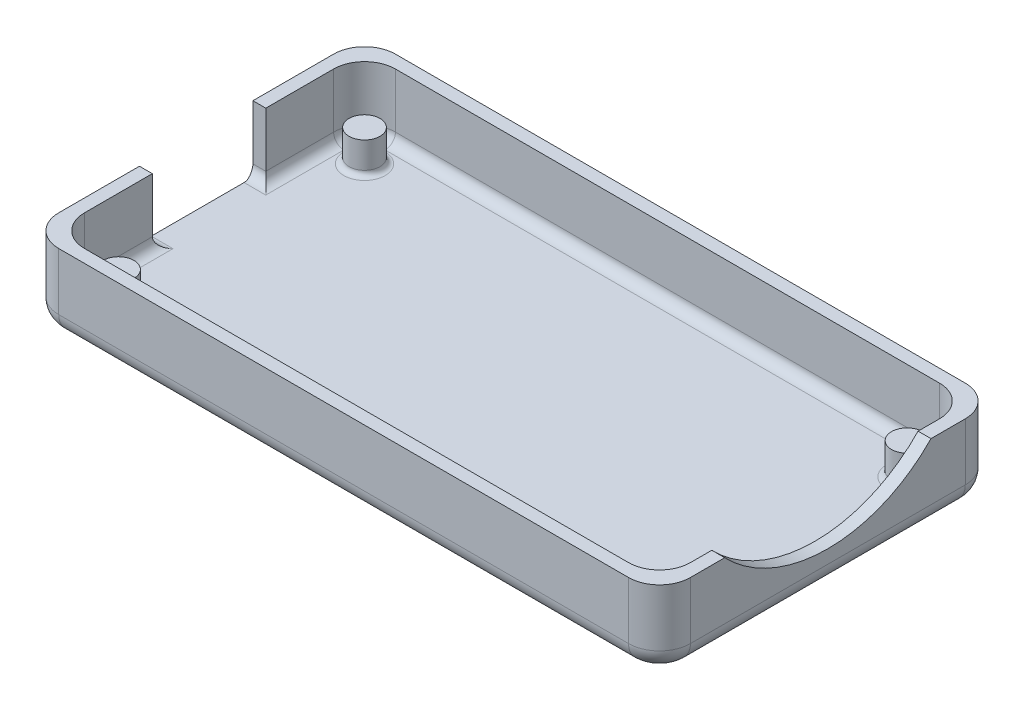
from build123d import *

# Parameters (mm, degrees)
BOSS_EXTRUDE2_DEPTH = 7.55
SKETCH3_W           = 58.75
SKETCH3_H           = 30.15
BOSS_EXTRUDE3_DEPTH = 1.25
SKETCH5_R           = 1.5
BOSS_EXTRUDE4_DEPTH = 3.05
FILLET1_R           = 0.5
FILLET4_R           = 2
SKETCH7_W           = 11
SKETCH7_H           = 6.3
CUT_EXTRUDE1_DEPTH  = 2
FILLET7_R           = 1
CUT_EXTRUDE2_DEPTH  = 2
FILLET8_R           = 1


with BuildPart() as part:
    # Sketch2 → Boss-Extrude2 (new body)
    with BuildSketch(Plane(origin=(0, 0, 0), x_dir=(1, 0, 0), z_dir=(0, 1, 0))):
        with BuildLine():
            Line((-54.15, 1.25), (1.1, 1.25))
            ThreePointArc((1.1, 1.25), (3.221320344, 0.371320344), (4.1, -1.75))
            Line((4.1, -1.75), (4.1, -28.4))
            ThreePointArc((4.1, -28.4), (3.221320344, -30.521320344), (1.1, -31.4))
            Line((1.1, -31.4), (-54.15, -31.4))
            ThreePointArc((-54.15, -31.4), (-56.271320344, -30.521320344), (-57.15, -28.4))
            Line((-57.15, -28.4), (-57.15, -1.75))
            ThreePointArc((-57.15, -1.75), (-56.271320344, 0.371320344), (-54.15, 1.25))
        make_face()
        with BuildLine():
            Line((-52.9, -30.15), (-0.15, -30.15))
            ThreePointArc((-0.15, -30.15), (1.971320344, -29.271320344), (2.85, -27.15))
            Line((2.85, -27.15), (2.85, -3))
            ThreePointArc((2.85, -3), (1.971320344, -0.878679656), (-0.15, 0))
            Line((-0.15, 0), (-52.9, 0))
            ThreePointArc((-52.9, 0), (-55.021320344, -0.878679656), (-55.9, -3))
            Line((-55.9, -3), (-55.9, -27.15))
            ThreePointArc((-55.9, -27.15), (-55.021320344, -29.271320344), (-52.9, -30.15))
        make_face(mode=Mode.SUBTRACT)
    extrude(amount=BOSS_EXTRUDE2_DEPTH)

    # Sketch3 → Boss-Extrude3 (add)
    with BuildSketch(Plane(origin=(0, 0, 0), x_dir=(1, 0, 0), z_dir=(0, 1, 0))):
        with Locations((-26.525, -15.075)):
            Rectangle(SKETCH3_W, SKETCH3_H)
    extrude(amount=BOSS_EXTRUDE3_DEPTH)

    # Sketch5 → Boss-Extrude4 (add)
    with BuildSketch(Plane(origin=(0, 1.25, 0), x_dir=(1, 0, 0), z_dir=(0, 1, 0))):
        with Locations(Location((-52.75, -3.15, 0), (0, 0, 270))):
            Circle(SKETCH5_R)
        with Locations(Location((-0.15, -3.15, 0), (0, 0, 270))):
            Circle(SKETCH5_R)
        with Locations(Location((-0.15, -27, 0), (0, 0, 270))):
            Circle(SKETCH5_R)
        with Locations(Location((-52.75, -27, 0), (0, 0, 270))):
            Circle(SKETCH5_R)
    extrude(amount=BOSS_EXTRUDE4_DEPTH)

    # Fillet1
    fillet1_edges = [part.edges().sort_by_distance(p)[0] for p in [
        (-52.75, 1.25, 25.5),
        (-52.75, 1.25, 1.65),
        (-0.15, 1.25, 1.65),
        (-0.15, 1.25, 25.5),
    ]]
    fillet(fillet1_edges, radius=FILLET1_R)

    # Fillet4
    fillet4_edges = [part.edges().sort_by_distance(p)[0] for p in [
        (4.1, 0, 15.075),
        (3.221320344, 0, 30.521320344),
        (-26.525, 0, 31.4),
        (-56.271320344, 0, 30.521320344),
        (-57.15, 0, 15.075),
        (-56.271320344, 0, -0.371320344),
        (-26.525, 0, -1.25),
        (3.221320344, 0, -0.371320344),
    ]]
    fillet(fillet4_edges, radius=FILLET4_R)

    # Sketch7 → Cut-Extrude1 (cut)
    with BuildSketch(Plane.ZY.offset(57.15)):
        with Locations((15.075, 4.4)):
            Rectangle(SKETCH7_W, SKETCH7_H)
    extrude(amount=-CUT_EXTRUDE1_DEPTH, mode=Mode.SUBTRACT)

    # Fillet7
    fillet7_edges = [part.edges().sort_by_distance(p)[0] for p in [
        (-55.9, 1.25, 23.8625),
        (-55.9, 1.25, 6.2875),
        (-55.021320344, 1.25, 29.271320344),
        (-26.525, 1.25, 30.15),
        (1.971320344, 1.25, 29.271320344),
        (2.85, 1.25, 15.075),
        (1.971320344, 1.25, 0.878679656),
        (-26.525, 1.25, 0),
        (-55.021320344, 1.25, 0.878679656),
    ]]
    fillet(fillet7_edges, radius=FILLET7_R - 0.0001)  # a hair under: the kernel refuses the full size

    # Sketch8 → Cut-Extrude2 (cut)
    with BuildSketch(Plane(origin=(4.1, 0, 0), x_dir=(0, 0, -1), z_dir=(1, 0, 0))):
        with BuildLine():
            Line((-5.075, 7.55), (-15.075, 7.55))
            Line((-15.075, 7.55), (-15.075, 3.3))
            ThreePointArc((-15.075, 3.3), (-9.642171547, 4.406580111), (-5.075, 7.55))
        make_face()
        with BuildLine():
            Line((-15.075, 3.3), (-15.075, 7.55))
            Line((-15.075, 7.55), (-25.075, 7.55))
            ThreePointArc((-25.075, 7.55), (-20.507828453, 4.406580111), (-15.075, 3.3))
        make_face()
    extrude(amount=-CUT_EXTRUDE2_DEPTH, mode=Mode.SUBTRACT)

    # Fillet8
    fillet8_edges = [part.edges().sort_by_distance(p)[0] for p in [
        (-55.952074811, 1.25, 20.575),
        (-55.952074811, 1.25, 9.575),
    ]]
    fillet(fillet8_edges, radius=FILLET8_R - 0.0001)  # a hair under: the kernel refuses the full size


solid = part.part
